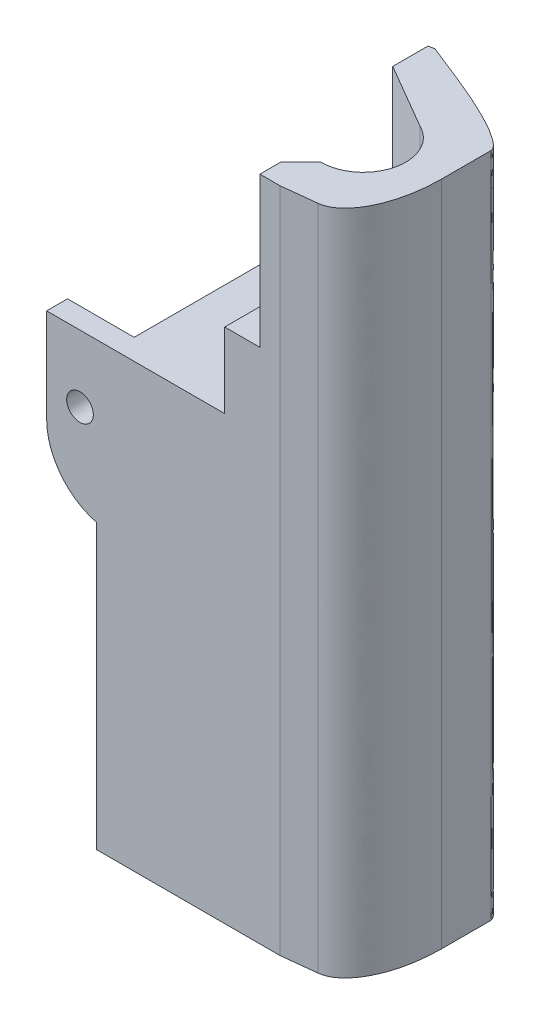
from build123d import *
from OCP.BRepFilletAPI import BRepFilletAPI_MakeChamfer

# Parameters (mm, degrees)
SKETCH1_R           = 5.1
BOSS_EXTRUDE1_DEPTH = 80
CUT_EXTRUDE2_START  = -18
CUT_EXTRUDE2_DEPTH  = 18
CUT_EXTRUDE3_DEPTH  = 9
SKETCH8_R           = 1.6
CUT_EXTRUDE5_DEPTH  = 10
SKETCH10_W          = 12.5
SKETCH10_H          = 2.5
BOSS_EXTRUDE3_DEPTH = 21
CHAMFER1_SIZE       = 11.3
CHAMFER1_SIZE2      = 12.156054871
CHAMFER2_SIZE       = 0.4
CHAMFER2_SIZE2      = 0.751123796
SKETCH11_W          = 6
SKETCH11_H          = 34
CUT_EXTRUDE6_DEPTH  = 10
FILLET3_R           = 8
CUT_EXTRUDE7_START  = -50.5
CUT_EXTRUDE7_DEPTH  = 42
CHAMFER4_START      = 8.5
CHAMFER4_DEPTH      = 42
CHAMFER4_2_DEPTH    = 42
FILLET4_R           = 4


with BuildPart() as part:
    # Sketch1 → Boss-Extrude1 (new body)
    with BuildSketch(Plane(origin=(0, 0, 0), x_dir=(1, 0, 0), z_dir=(0, 1, 0))):
        Polygon((0, -10), (9, -9), (9, 8), (-20, 19.5), (-20, 18), (-7.5, 13.043103448), (-7.5, -7.5), (-28, -7.5), (-28, -10), align=None)
        with Locations(Location((0, 0, 0), (0, 0, 270))):
            Circle(SKETCH1_R, mode=Mode.SUBTRACT)
    extrude(amount=BOSS_EXTRUDE1_DEPTH)

    # Fillet1
    # a fillet whose section is not a circle: 10, 6 mm, written as the material it takes off along each edge
    with BuildSketch(Plane(origin=(9, -23.487180939, 9), x_dir=(-0.993883734673619, 0, 0.11043152607484658), z_dir=(0, 1, 0))) as fillet1_piece_1:
        with BuildLine():
            Bezier((4.925812314, 0), (0, 0), (-1.037490094, -9.337410844), weights=[1, 0.745128018, 1])
            Line((-1.037490094, -9.337410844), (0, 0))
            Line((0, 0), (4.925812314, 0))
        make_face()
    extrude(amount=126.974361879, mode=Mode.SUBTRACT)

    # Fillet2
    # a fillet whose section is not a circle: 12, 6 mm, written as the material it takes off along each edge
    with BuildSketch(Plane(origin=(9, -26.324436186, -8), x_dir=(-0.9295779033226579, 0, -0.368625720283123), z_dir=(0, 1, 0))) as fillet2_piece_1:
        with BuildLine():
            Bezier((10.529774474, 0), (0, 0), (-0.625160366, 1.576491357), weights=[1, 0.827232047, 1])
            Line((-0.625160366, 1.576491357), (0, 0))
            Line((0, 0), (10.529774474, 0))
        make_face()
    extrude(amount=132.648872372, mode=Mode.SUBTRACT)

    # Sketch5 → Cut-Extrude2 (cut)
    with BuildSketch(Plane(origin=(0, 80, 0), x_dir=(1, 0, 0), z_dir=(0, 1, 0)).offset(CUT_EXTRUDE2_START)):
        with BuildLine():
            Line((-40.382705662, 23.287650548), (-40.382705662, -15.07166092))
            Line((-40.382705662, -15.07166092), (-2.412422064, -15.07166092))
            Line((-2.412422064, -15.07166092), (-2.412422064, -7.512422064))
            Line((-2.412422064, -7.512422064), (0, -5.1))
            ThreePointArc((0, -5.1), (4.863777761, -1.534166188), (2.926213093, 4.176993768))
            Line((2.926213093, 4.176993768), (-5.637939913, 9.164476421))
            Line((-5.637939913, 9.164476421), (-5.637939913, 23.287650548))
            Line((-5.637939913, 23.287650548), (-40.382705662, 23.287650548))
        make_face()
    extrude(amount=CUT_EXTRUDE2_DEPTH, mode=Mode.SUBTRACT)

    # Sketch6 → Cut-Extrude3 (cut)
    with BuildSketch(Plane(origin=(0, 62, 0), x_dir=(1, 0, 0), z_dir=(0, 1, 0))):
        Polygon((-6.637939913, -10), (-28, -10), (-28, 21.40414119), (-6.637939913, 21.40414119), (-5.637939913, 21.40414119), (-5.637939913, 9.164476421), (-6.637939913, 4.905415269), align=None)
    extrude(amount=-CUT_EXTRUDE3_DEPTH, mode=Mode.SUBTRACT)

    # Sketch8 → Cut-Extrude5 (cut)
    with BuildSketch(Plane.XY.offset(10)):
        with Locations((-24, 45)):
            Circle(SKETCH8_R)
    extrude(amount=-CUT_EXTRUDE5_DEPTH, mode=Mode.SUBTRACT)

    # Sketch10 → Boss-Extrude3 (add)
    with BuildSketch(Plane(origin=(0, 0, 7.5), x_dir=(-1, 0, 0), z_dir=(0, 0, -1))):
        with Locations((13.75, 51.75)):
            Rectangle(SKETCH10_W, SKETCH10_H)
    extrude(amount=BOSS_EXTRUDE3_DEPTH)

    # Chamfer1
    chamfer1_edges = [part.edges().sort_by_distance(p)[0] for p in [
        (-8.652173913, 51.75, -13.5),
    ]]
    chamfer1_side = [part.faces().sort_by_distance(p)[0] for p in [
        (-14.326086957, 51.75, -13.5),
    ]]
    chamfer(chamfer1_edges, length=CHAMFER1_SIZE, length2=CHAMFER1_SIZE2, reference=chamfer1_side[0])

    # Chamfer2: one chamfer whose edges measure the first distance from different faces: ONE call of the kernel's chamfer builder (chamfer() names one face for all edges)
    chamfer2_edges_1 = [part.edges().sort_by_distance(p)[0] for p in [
        (-5.637939913, 66.5, -13.80470031),
    ]]
    chamfer2_side_1 = [part.faces().sort_by_distance(p)[0] for p in [
        (-5.637939913, 66.5, -11.484588366),
    ]]
    chamfer2_edges_2 = [part.edges().sort_by_distance(p)[0] for p in [
        (-20, 26.5, -19.5),
    ]]
    chamfer2_side_2 = [part.faces().sort_by_distance(p)[0] for p in [
        (-20, 26.5, -18.75),
    ]]
    chamfer2 = BRepFilletAPI_MakeChamfer(part.part.solid().wrapped)
    for e in chamfer2_edges_1:
        chamfer2.Add(CHAMFER2_SIZE, CHAMFER2_SIZE2, e.wrapped, chamfer2_side_1[0].wrapped)  # the first distance lies on this face
    for e in chamfer2_edges_2:
        chamfer2.Add(CHAMFER2_SIZE, CHAMFER2_SIZE2, e.wrapped, chamfer2_side_2[0].wrapped)  # the first distance lies on this face
    add(Compound.cast(chamfer2.Shape()), mode=Mode.REPLACE)

    # Sketch11 → Cut-Extrude6 (cut)
    with BuildSketch(Plane(origin=(0, 0, 7.5), x_dir=(-1, 0, 0), z_dir=(0, 0, -1))):
        with Locations((25, 17)):
            Rectangle(SKETCH11_W, SKETCH11_H)
    extrude(amount=-CUT_EXTRUDE6_DEPTH, mode=Mode.SUBTRACT)

    # Fillet3
    # the kernel refuses this fillet: 8 mm, written as the material it takes off along each edge
    with BuildSketch(Plane(origin=(-28, 34, -11.864916731), x_dir=(0, 1, 0), z_dir=(0, 0, 1))) as fillet3_piece_1:
        with BuildLine():
            CenterArc((7.745966692, -8), FILLET3_R, 90, 75.522487814)
            Line((0, -6), (-0.154919334, -5.96))
            ThreePointArc((-0.154919334, -5.96), (-0.16, -3), (-0.16, 0))
            Line((-0.16, 0), (0, 0.16))
            Line((0, 0.16), (7.745966692, 0.16))
            Line((7.745966692, 0.16), (7.745966692, 0))
        make_face()
    extrude(amount=41.229833462, mode=Mode.SUBTRACT)

    # Sketch12 → Cut-Extrude7 (cut)
    with BuildSketch(Plane.XZ.offset(CUT_EXTRUDE7_START)):
        Polygon((-7.5, -13.043103448), (0, -9.648284322), (0, 6.91148674), (-7.5, 7.5), align=None)
    extrude(amount=CUT_EXTRUDE7_DEPTH, mode=Mode.SUBTRACT)

    # Chamfer3
    # the kernel refuses this chamfer: 10 mm, written as the material it takes off along each edge
    with BuildSketch(Plane(origin=(0, 50.5, -5.1), x_dir=(0.9352222959192602, 0, 0.3540610924904171), z_dir=(0, -1, 0))) as chamfer3_piece_1_section:
        with BuildLine():
            Line((3.894265856, 0.282842712), (-2.483031603, -6.094454747))
            Line((-2.483031603, -6.094454747), (-2.670076063, -6.023642528))
            ThreePointArc((-2.670076063, -6.023642528), (-1.351695644, -3.005514942), (-0.187044459, 0.070812218))
            Line((-0.187044459, 0.070812218), (0.070812218, 0.187044459))
            ThreePointArc((0.070812218, 0.187044459), (1.955367921, -0.128080347), (3.823453637, 0.469887172))
            Line((3.823453637, 0.469887172), (3.894265856, 0.282842712))
        make_face()
    chamfer3_piece_1 = extrude(amount=42, mode=Mode.PRIVATE)
    chamfer3_piece_1 = split(chamfer3_piece_1, bisect_by=Plane(origin=(1.70866642, 50.5, -8.874869196), z_dir=(-0.4123656941532171, 0, 0.9110184050201925)), keep=Keep.TOP, mode=Mode.PRIVATE)
    add(chamfer3_piece_1, mode=Mode.SUBTRACT)

    # Chamfer4: read off the stored shape, not the designer's step
    # Chamfer4 outline → Chamfer4 (cut)
    with BuildSketch(Plane(origin=(0, 0, 0), x_dir=(1, 0, 0), z_dir=(0, 1, 0)).offset(CHAMFER4_START)):
        with BuildLine():
            Line((0, -5.1), (0, -6.228017105))
            Line((0, -6.228017105), (2.673318305, -4.343198043))
            ThreePointArc((2.673318305, -4.343198043), (1.389188609, -4.907153453), (0, -5.1))
        make_face()
    extrude(amount=CHAMFER4_DEPTH, mode=Mode.SUBTRACT)

    # Chamfer4 2 outline → Chamfer4 2 (add)
    with BuildSketch(Plane(origin=(0, 0, 0), x_dir=(1, 0, 0), z_dir=(0, 1, 0)).offset(CHAMFER4_START)):
        with BuildLine():
            Line((3.192787517, -3.976947054), (2.673318305, -4.343198043))
            ThreePointArc((2.673318305, -4.343198043), (2.938764081, -4.168172942), (3.192787517, -3.976947054))
        make_face()
    extrude(amount=CHAMFER4_2_DEPTH)

    # Fillet4
    # the kernel refuses this fillet: 4 mm, written as the material it adds along each edge
    with BuildSketch(Plane(origin=(-7.5, 0, 7.5), x_dir=(-1, 0, 0), z_dir=(0, 1, 0))) as fillet4_piece_1:
        with BuildLine():
            CenterArc((FILLET4_R, -FILLET4_R), FILLET4_R, 90, 90)
            Line((0, -FILLET4_R), (0, 0))
            Line((0, 0), (FILLET4_R, 0))
        make_face()
    extrude(amount=8.5)
    with BuildSketch(Plane(origin=(-7.5, 0, -13.043103448), x_dir=(-0.9295779033226581, 0, -0.3686257202831227), z_dir=(0, 1, 0))) as fillet4_piece_2:
        with BuildLine():
            CenterArc((FILLET4_R * 0.679205344125, FILLET4_R), FILLET4_R, 201.630886837, 68.369113163)
            Line((-FILLET4_R * 0.250372559198, FILLET4_R * 0.631374279717), (0, 0))
            Line((0, 0), (FILLET4_R * 0.679205344125, 0))
        make_face()
    extrude(amount=8.5)


solid = part.part
